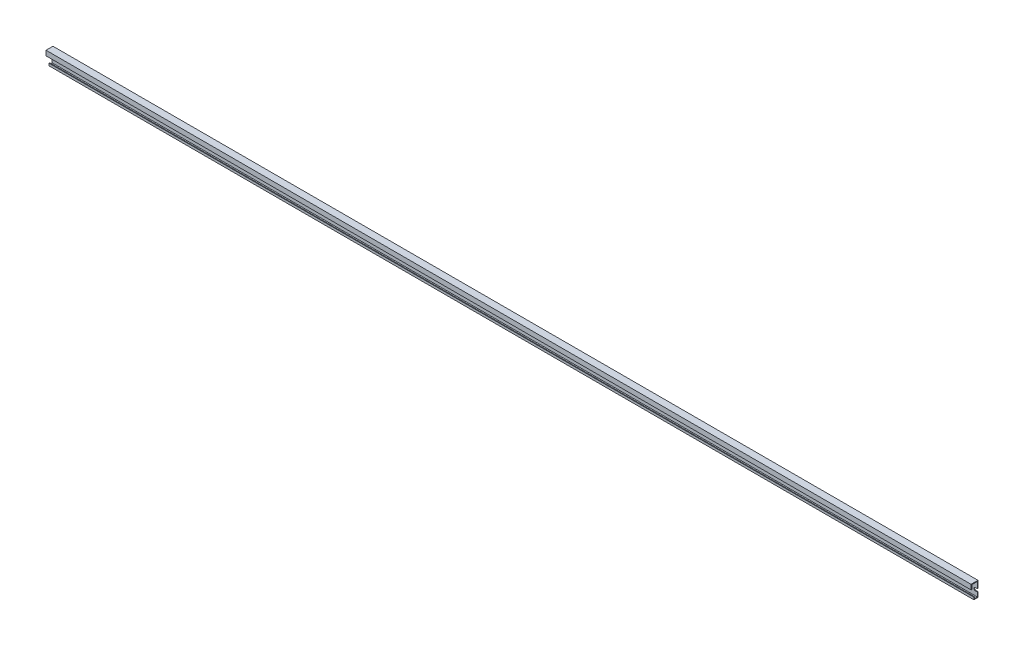
from build123d import *

# Parameters (mm, degrees)
SKETCH1_W           = 2000
SKETCH1_H           = 9
BOSS_EXTRUDE1_DEPTH = 5
SKETCH2_W           = 7.5
SKETCH2_H           = 3.5
CUT_EXTRUDE1_DEPTH  = 2001.084248226
SKETCH3_W           = 2000
SKETCH3_H           = 1.5
BOSS_EXTRUDE2_DEPTH = 30.5
SKETCH4_W           = 2000
SKETCH4_H           = 1.5
BOSS_EXTRUDE3_DEPTH = 13.5
SKETCH5_W           = 2000
SKETCH5_H           = 1.5
BOSS_EXTRUDE4_DEPTH = 9
CUT_EXTRUDE2_DEPTH  = 2001.120246385
CUT_EXTRUDE3_DEPTH  = 2001.120246385
CUT_EXTRUDE4_DEPTH  = 2001.109559499
CUT_EXTRUDE5_DEPTH  = 2001.109559499
CUT_EXTRUDE6_DEPTH  = 2001.109559499
CUT_EXTRUDE7_DEPTH  = 2001.109559499
CUT_EXTRUDE8_DEPTH  = 2001.109559499
CUT_EXTRUDE9_DEPTH  = 2001.109559499
CUT_EXTRUDE10_DEPTH = 2001.109559499
CUT_EXTRUDE11_DEPTH = 2001.109559499
CUT_EXTRUDE12_DEPTH = 2001.109559499
CUT_EXTRUDE13_DEPTH = 2001.109559499
CUT_EXTRUDE14_DEPTH = 2001.109559499
CUT_EXTRUDE15_DEPTH = 2001.109559499
CUT_EXTRUDE16_DEPTH = 2001.109559499
CUT_EXTRUDE17_DEPTH = 2001.109559499
CUT_EXTRUDE18_DEPTH = 2001.109559499
CUT_EXTRUDE19_DEPTH = 2001.109559499
CUT_EXTRUDE20_DEPTH = 2001.109559499
CUT_EXTRUDE21_DEPTH = 2001.109559499
CUT_EXTRUDE22_DEPTH = 2001.109559499
CUT_EXTRUDE23_DEPTH = 2001.109559499
CUT_EXTRUDE24_DEPTH = 2001.109559499
CUT_EXTRUDE25_DEPTH = 2001.109559499
CUT_EXTRUDE26_DEPTH = 2001.109559499
CUT_EXTRUDE27_DEPTH = 2001.109559499
CUT_EXTRUDE28_DEPTH = 2001.109559499
CUT_EXTRUDE29_DEPTH = 2001.109559499
CUT_EXTRUDE30_DEPTH = 2001.109559499
CUT_EXTRUDE31_DEPTH = 2001.109559499
CUT_EXTRUDE32_DEPTH = 2001.109559499
CUT_EXTRUDE33_DEPTH = 2001.109559499
CUT_EXTRUDE34_DEPTH = 2001.109559499
CUT_EXTRUDE35_DEPTH = 2001.109559499
CUT_EXTRUDE36_DEPTH = 2001.109559499
CUT_EXTRUDE37_DEPTH = 2001.109559499
CUT_EXTRUDE38_DEPTH = 2001.109559499
CUT_EXTRUDE39_DEPTH = 2001.109559499
CUT_EXTRUDE40_DEPTH = 2001.109559499
CUT_EXTRUDE41_DEPTH = 2001.109559499
CUT_EXTRUDE42_DEPTH = 2001.109559499
CUT_EXTRUDE43_DEPTH = 2001.109559499
CUT_EXTRUDE44_DEPTH = 2001.109559499
CUT_EXTRUDE45_DEPTH = 2001.109559499
CUT_EXTRUDE46_DEPTH = 2001.109559499
CUT_EXTRUDE47_DEPTH = 2001.109559499
CUT_EXTRUDE48_DEPTH = 2001.109559499
CUT_EXTRUDE49_DEPTH = 2001.109559499
CUT_EXTRUDE50_DEPTH = 2001.109559499
CUT_EXTRUDE51_DEPTH = 2001.109559499
CUT_EXTRUDE52_DEPTH = 2001.109559499
CUT_EXTRUDE53_DEPTH = 2001.109559499
CUT_EXTRUDE54_DEPTH = 2001.109559499
CUT_EXTRUDE55_DEPTH = 2001.109559499
CUT_EXTRUDE56_DEPTH = 2001.109559499
CUT_EXTRUDE57_DEPTH = 2001.109559499
CUT_EXTRUDE58_DEPTH = 2001.109559499
CUT_EXTRUDE59_DEPTH = 2001.109559499
CUT_EXTRUDE60_DEPTH = 2001.109559499
CUT_EXTRUDE61_DEPTH = 2001.109559499
CUT_EXTRUDE62_DEPTH = 2001.109559499
CUT_EXTRUDE63_DEPTH = 2001.109559499
CUT_EXTRUDE64_DEPTH = 2001.109559499
CUT_EXTRUDE65_DEPTH = 2001.109559499
CUT_EXTRUDE66_DEPTH = 2001.109559499
CUT_EXTRUDE67_DEPTH = 2001.109559499
CUT_EXTRUDE68_DEPTH = 2001.109559499
CUT_EXTRUDE69_DEPTH = 2001.109559499
CUT_EXTRUDE70_DEPTH = 2001.109559499
CUT_EXTRUDE71_DEPTH = 2001.109559499
CUT_EXTRUDE72_DEPTH = 2001.109559499
CUT_EXTRUDE73_DEPTH = 2001.109559499
CUT_EXTRUDE74_DEPTH = 2001.109559499
CUT_EXTRUDE75_DEPTH = 2001.109559499
CUT_EXTRUDE76_DEPTH = 2001.109559499
CUT_EXTRUDE77_DEPTH = 2001.109559499
CUT_EXTRUDE78_DEPTH = 2001.109559499
CUT_EXTRUDE79_DEPTH = 2001.109559499
CUT_EXTRUDE80_DEPTH = 2001.109559499
CUT_EXTRUDE81_DEPTH = 2001.109559499
CUT_EXTRUDE82_DEPTH = 2001.120246385


with BuildPart() as part:
    # Sketch1 → Boss-Extrude1 (new body)
    with BuildSketch(Plane(origin=(0, -11, 0), x_dir=(1, 0, 0), z_dir=(0, 1, 0))):
        with Locations((1000, -4.5)):
            Rectangle(SKETCH1_W, SKETCH1_H)
    extrude(amount=-BOSS_EXTRUDE1_DEPTH)

    # Sketch2 → Cut-Extrude1 (cut, through all)
    with BuildSketch(Plane.ZY):
        with Locations((3.75, -12.75)):
            Rectangle(SKETCH2_W, SKETCH2_H)
    extrude(amount=-CUT_EXTRUDE1_DEPTH, mode=Mode.SUBTRACT)

    # Sketch3 → Boss-Extrude2 (add)
    with BuildSketch(Plane(origin=(0, -14.5, 0), x_dir=(-1, 0, 0), z_dir=(0, 1, 0))):
        with Locations((-1000, 0.75)):
            Rectangle(SKETCH3_W, SKETCH3_H)
    extrude(amount=BOSS_EXTRUDE2_DEPTH)

    # Sketch4 → Boss-Extrude3 (add)
    with BuildSketch(Plane.XY.offset(1.5)):
        with Locations((1000, 15.25)):
            Rectangle(SKETCH4_W, SKETCH4_H)
    extrude(amount=BOSS_EXTRUDE3_DEPTH)

    # Sketch5 → Boss-Extrude4 (add)
    with BuildSketch(Plane.XZ.offset(-14.5)):
        with Locations((1000, 14.25)):
            Rectangle(SKETCH5_W, SKETCH5_H)
    extrude(amount=BOSS_EXTRUDE4_DEPTH)

    # Sketch6 → Cut-Extrude2 (cut, through all)
    with BuildSketch(Plane(origin=(0, 0, 0), x_dir=(-1, 0, 0), z_dir=(0, 0, -1))):
        with BuildLine():
            Line((0, -5.1), (0, 1.1))
            Line((0, 1.1), (-4.4, 1.1))
            ThreePointArc((-4.4, 1.1), (-7.5, -2), (-4.4, -5.1))
            Line((-4.4, -5.1), (0, -5.1))
        make_face()
    extrude(amount=-CUT_EXTRUDE2_DEPTH, mode=Mode.SUBTRACT)

    # Sketch7 → Cut-Extrude3 (cut, through all)
    with BuildSketch(Plane(origin=(0, 0, 0), x_dir=(-1, 0, 0), z_dir=(0, 0, -1))):
        with BuildLine():
            Line((-2000, 1.1), (-2000, -5.1))
            Line((-2000, -5.1), (-1995.6, -5.1))
            ThreePointArc((-1995.6, -5.1), (-1992.5, -2), (-1995.6, 1.1))
            Line((-1995.6, 1.1), (-2000, 1.1))
        make_face()
    extrude(amount=-CUT_EXTRUDE3_DEPTH, mode=Mode.SUBTRACT)

    # Sketch8 → Cut-Extrude4 (cut, through all)
    with BuildSketch(Plane.XY.offset(1.5)):
        with BuildLine():
            Line((1229.4, 1.1), (1220.6, 1.1))
            ThreePointArc((1220.6, 1.1), (1217.5, -2), (1220.6, -5.1))
            Line((1220.6, -5.1), (1229.4, -5.1))
            ThreePointArc((1229.4, -5.1), (1232.5, -2), (1229.4, 1.1))
        make_face()
    extrude(amount=-CUT_EXTRUDE4_DEPTH, mode=Mode.SUBTRACT)

    # Sketch9 → Cut-Extrude5 (cut, through all)
    with BuildSketch(Plane.XY.offset(1.5)):
        with BuildLine():
            Line((279.4, 1.1), (270.6, 1.1))
            ThreePointArc((270.6, 1.1), (267.5, -2), (270.6, -5.1))
            Line((270.6, -5.1), (279.4, -5.1))
            ThreePointArc((279.4, -5.1), (282.5, -2), (279.4, 1.1))
        make_face()
    extrude(amount=-CUT_EXTRUDE5_DEPTH, mode=Mode.SUBTRACT)

    # Sketch10 → Cut-Extrude6 (cut, through all)
    with BuildSketch(Plane.XY.offset(1.5)):
        with BuildLine():
            Line((1404.4, 1.1), (1395.6, 1.1))
            ThreePointArc((1395.6, 1.1), (1392.5, -2), (1395.6, -5.1))
            Line((1395.6, -5.1), (1404.4, -5.1))
            ThreePointArc((1404.4, -5.1), (1407.5, -2), (1404.4, 1.1))
        make_face()
    extrude(amount=-CUT_EXTRUDE6_DEPTH, mode=Mode.SUBTRACT)

    # Sketch11 → Cut-Extrude7 (cut, through all)
    with BuildSketch(Plane.XY.offset(1.5)):
        with BuildLine():
            Line((1729.4, 1.1), (1720.6, 1.1))
            ThreePointArc((1720.6, 1.1), (1717.5, -2), (1720.6, -5.1))
            Line((1720.6, -5.1), (1729.4, -5.1))
            ThreePointArc((1729.4, -5.1), (1732.5, -2), (1729.4, 1.1))
        make_face()
    extrude(amount=-CUT_EXTRUDE7_DEPTH, mode=Mode.SUBTRACT)

    # Sketch12 → Cut-Extrude8 (cut, through all)
    with BuildSketch(Plane.XY.offset(1.5)):
        with BuildLine():
            Line((1954.4, 1.1), (1945.6, 1.1))
            ThreePointArc((1945.6, 1.1), (1942.5, -2), (1945.6, -5.1))
            Line((1945.6, -5.1), (1954.4, -5.1))
            ThreePointArc((1954.4, -5.1), (1957.5, -2), (1954.4, 1.1))
        make_face()
    extrude(amount=-CUT_EXTRUDE8_DEPTH, mode=Mode.SUBTRACT)

    # Sketch13 → Cut-Extrude9 (cut, through all)
    with BuildSketch(Plane.XY.offset(1.5)):
        with BuildLine():
            Line((679.4, 1.1), (670.6, 1.1))
            ThreePointArc((670.6, 1.1), (667.5, -2), (670.6, -5.1))
            Line((670.6, -5.1), (679.4, -5.1))
            ThreePointArc((679.4, -5.1), (682.5, -2), (679.4, 1.1))
        make_face()
    extrude(amount=-CUT_EXTRUDE9_DEPTH, mode=Mode.SUBTRACT)

    # Sketch14 → Cut-Extrude10 (cut, through all)
    with BuildSketch(Plane.XY.offset(1.5)):
        with BuildLine():
            Line((29.4, 1.1), (20.6, 1.1))
            ThreePointArc((20.6, 1.1), (17.5, -2), (20.6, -5.1))
            Line((20.6, -5.1), (29.4, -5.1))
            ThreePointArc((29.4, -5.1), (32.5, -2), (29.4, 1.1))
        make_face()
    extrude(amount=-CUT_EXTRUDE10_DEPTH, mode=Mode.SUBTRACT)

    # Sketch15 → Cut-Extrude11 (cut, through all)
    with BuildSketch(Plane.XY.offset(1.5)):
        with BuildLine():
            Line((1979.4, 1.1), (1970.6, 1.1))
            ThreePointArc((1970.6, 1.1), (1967.5, -2), (1970.6, -5.1))
            Line((1970.6, -5.1), (1979.4, -5.1))
            ThreePointArc((1979.4, -5.1), (1982.5, -2), (1979.4, 1.1))
        make_face()
    extrude(amount=-CUT_EXTRUDE11_DEPTH, mode=Mode.SUBTRACT)

    # Sketch16 → Cut-Extrude12 (cut, through all)
    with BuildSketch(Plane.XY.offset(1.5)):
        with BuildLine():
            Line((104.4, 1.1), (95.6, 1.1))
            ThreePointArc((95.6, 1.1), (92.5, -2), (95.6, -5.1))
            Line((95.6, -5.1), (104.4, -5.1))
            ThreePointArc((104.4, -5.1), (107.5, -2), (104.4, 1.1))
        make_face()
    extrude(amount=-CUT_EXTRUDE12_DEPTH, mode=Mode.SUBTRACT)

    # Sketch17 → Cut-Extrude13 (cut, through all)
    with BuildSketch(Plane.XY.offset(1.5)):
        with BuildLine():
            Line((1479.4, 1.1), (1470.6, 1.1))
            ThreePointArc((1470.6, 1.1), (1467.5, -2), (1470.6, -5.1))
            Line((1470.6, -5.1), (1479.4, -5.1))
            ThreePointArc((1479.4, -5.1), (1482.5, -2), (1479.4, 1.1))
        make_face()
    extrude(amount=-CUT_EXTRUDE13_DEPTH, mode=Mode.SUBTRACT)

    # Sketch18 → Cut-Extrude14 (cut, through all)
    with BuildSketch(Plane.XY.offset(1.5)):
        with BuildLine():
            Line((295.6, -5.1), (304.4, -5.1))
            ThreePointArc((304.4, -5.1), (307.5, -2), (304.4, 1.1))
            Line((304.4, 1.1), (295.6, 1.1))
            ThreePointArc((295.6, 1.1), (292.5, -2), (295.6, -5.1))
        make_face()
    extrude(amount=-CUT_EXTRUDE14_DEPTH, mode=Mode.SUBTRACT)

    # Sketch19 → Cut-Extrude15 (cut, through all)
    with BuildSketch(Plane.XY.offset(1.5)):
        with BuildLine():
            Line((170.6, -5.1), (179.4, -5.1))
            ThreePointArc((179.4, -5.1), (182.5, -2), (179.4, 1.1))
            Line((179.4, 1.1), (170.6, 1.1))
            ThreePointArc((170.6, 1.1), (167.5, -2), (170.6, -5.1))
        make_face()
    extrude(amount=-CUT_EXTRUDE15_DEPTH, mode=Mode.SUBTRACT)

    # Sketch20 → Cut-Extrude16 (cut, through all)
    with BuildSketch(Plane.XY.offset(1.5)):
        with BuildLine():
            Line((1320.6, -5.1), (1329.4, -5.1))
            ThreePointArc((1329.4, -5.1), (1332.5, -2), (1329.4, 1.1))
            Line((1329.4, 1.1), (1320.6, 1.1))
            ThreePointArc((1320.6, 1.1), (1317.5, -2), (1320.6, -5.1))
        make_face()
    extrude(amount=-CUT_EXTRUDE16_DEPTH, mode=Mode.SUBTRACT)

    # Sketch21 → Cut-Extrude17 (cut, through all)
    with BuildSketch(Plane.XY.offset(1.5)):
        with BuildLine():
            Line((704.4, 1.1), (695.6, 1.1))
            ThreePointArc((695.6, 1.1), (692.5, -2), (695.6, -5.1))
            Line((695.6, -5.1), (704.4, -5.1))
            ThreePointArc((704.4, -5.1), (707.5, -2), (704.4, 1.1))
        make_face()
    extrude(amount=-CUT_EXTRUDE17_DEPTH, mode=Mode.SUBTRACT)

    # Sketch22 → Cut-Extrude18 (cut, through all)
    with BuildSketch(Plane.XY.offset(1.5)):
        with BuildLine():
            Line((379.4, 1.1), (370.6, 1.1))
            ThreePointArc((370.6, 1.1), (367.5, -2), (370.6, -5.1))
            Line((370.6, -5.1), (379.4, -5.1))
            ThreePointArc((379.4, -5.1), (382.5, -2), (379.4, 1.1))
        make_face()
    extrude(amount=-CUT_EXTRUDE18_DEPTH, mode=Mode.SUBTRACT)

    # Sketch23 → Cut-Extrude19 (cut, through all)
    with BuildSketch(Plane.XY.offset(1.5)):
        with BuildLine():
            Line((1554.4, 1.1), (1545.6, 1.1))
            ThreePointArc((1545.6, 1.1), (1542.5, -2), (1545.6, -5.1))
            Line((1545.6, -5.1), (1554.4, -5.1))
            ThreePointArc((1554.4, -5.1), (1557.5, -2), (1554.4, 1.1))
        make_face()
    extrude(amount=-CUT_EXTRUDE19_DEPTH, mode=Mode.SUBTRACT)

    # Sketch24 → Cut-Extrude20 (cut, through all)
    with BuildSketch(Plane.XY.offset(1.5)):
        with BuildLine():
            Line((1704.4, 1.1), (1695.6, 1.1))
            ThreePointArc((1695.6, 1.1), (1692.5, -2), (1695.6, -5.1))
            Line((1695.6, -5.1), (1704.4, -5.1))
            ThreePointArc((1704.4, -5.1), (1707.5, -2), (1704.4, 1.1))
        make_face()
    extrude(amount=-CUT_EXTRUDE20_DEPTH, mode=Mode.SUBTRACT)

    # Sketch25 → Cut-Extrude21 (cut, through all)
    with BuildSketch(Plane.XY.offset(1.5)):
        with BuildLine():
            Line((1004.4, 1.1), (995.6, 1.1))
            ThreePointArc((995.6, 1.1), (992.5, -2), (995.6, -5.1))
            Line((995.6, -5.1), (1004.4, -5.1))
            ThreePointArc((1004.4, -5.1), (1007.5, -2), (1004.4, 1.1))
        make_face()
    extrude(amount=-CUT_EXTRUDE21_DEPTH, mode=Mode.SUBTRACT)

    # Sketch26 → Cut-Extrude22 (cut, through all)
    with BuildSketch(Plane.XY.offset(1.5)):
        with BuildLine():
            Line((545.6, -5.1), (554.4, -5.1))
            ThreePointArc((554.4, -5.1), (557.5, -2), (554.4, 1.1))
            Line((554.4, 1.1), (545.6, 1.1))
            ThreePointArc((545.6, 1.1), (542.5, -2), (545.6, -5.1))
        make_face()
    extrude(amount=-CUT_EXTRUDE22_DEPTH, mode=Mode.SUBTRACT)

    # Sketch27 → Cut-Extrude23 (cut, through all)
    with BuildSketch(Plane.XY.offset(1.5)):
        with BuildLine():
            Line((845.6, -5.1), (854.4, -5.1))
            ThreePointArc((854.4, -5.1), (857.5, -2), (854.4, 1.1))
            Line((854.4, 1.1), (845.6, 1.1))
            ThreePointArc((845.6, 1.1), (842.5, -2), (845.6, -5.1))
        make_face()
    extrude(amount=-CUT_EXTRUDE23_DEPTH, mode=Mode.SUBTRACT)

    # Sketch28 → Cut-Extrude24 (cut, through all)
    with BuildSketch(Plane.XY.offset(1.5)):
        with BuildLine():
            Line((879.4, 1.1), (870.6, 1.1))
            ThreePointArc((870.6, 1.1), (867.5, -2), (870.6, -5.1))
            Line((870.6, -5.1), (879.4, -5.1))
            ThreePointArc((879.4, -5.1), (882.5, -2), (879.4, 1.1))
        make_face()
    extrude(amount=-CUT_EXTRUDE24_DEPTH, mode=Mode.SUBTRACT)

    # Sketch29 → Cut-Extrude25 (cut, through all)
    with BuildSketch(Plane.XY.offset(1.5)):
        with BuildLine():
            Line((354.4, 1.1), (345.6, 1.1))
            ThreePointArc((345.6, 1.1), (342.5, -2), (345.6, -5.1))
            Line((345.6, -5.1), (354.4, -5.1))
            ThreePointArc((354.4, -5.1), (357.5, -2), (354.4, 1.1))
        make_face()
    extrude(amount=-CUT_EXTRUDE25_DEPTH, mode=Mode.SUBTRACT)

    # Sketch30 → Cut-Extrude26 (cut, through all)
    with BuildSketch(Plane.XY.offset(1.5)):
        with BuildLine():
            Line((1679.4, 1.1), (1670.6, 1.1))
            ThreePointArc((1670.6, 1.1), (1667.5, -2), (1670.6, -5.1))
            Line((1670.6, -5.1), (1679.4, -5.1))
            ThreePointArc((1679.4, -5.1), (1682.5, -2), (1679.4, 1.1))
        make_face()
    extrude(amount=-CUT_EXTRUDE26_DEPTH, mode=Mode.SUBTRACT)

    # Sketch31 → Cut-Extrude27 (cut, through all)
    with BuildSketch(Plane.XY.offset(1.5)):
        with BuildLine():
            Line((395.6, -5.1), (404.4, -5.1))
            ThreePointArc((404.4, -5.1), (407.5, -2), (404.4, 1.1))
            Line((404.4, 1.1), (395.6, 1.1))
            ThreePointArc((395.6, 1.1), (392.5, -2), (395.6, -5.1))
        make_face()
    extrude(amount=-CUT_EXTRUDE27_DEPTH, mode=Mode.SUBTRACT)

    # Sketch32 → Cut-Extrude28 (cut, through all)
    with BuildSketch(Plane.XY.offset(1.5)):
        with BuildLine():
            Line((1454.4, 1.1), (1445.6, 1.1))
            ThreePointArc((1445.6, 1.1), (1442.5, -2), (1445.6, -5.1))
            Line((1445.6, -5.1), (1454.4, -5.1))
            ThreePointArc((1454.4, -5.1), (1457.5, -2), (1454.4, 1.1))
        make_face()
    extrude(amount=-CUT_EXTRUDE28_DEPTH, mode=Mode.SUBTRACT)

    # Sketch33 → Cut-Extrude29 (cut, through all)
    with BuildSketch(Plane.XY.offset(1.5)):
        with BuildLine():
            Line((54.4, 1.1), (45.6, 1.1))
            ThreePointArc((45.6, 1.1), (42.5, -2), (45.6, -5.1))
            Line((45.6, -5.1), (54.4, -5.1))
            ThreePointArc((54.4, -5.1), (57.5, -2), (54.4, 1.1))
        make_face()
    extrude(amount=-CUT_EXTRUDE29_DEPTH, mode=Mode.SUBTRACT)

    # Sketch34 → Cut-Extrude30 (cut, through all)
    with BuildSketch(Plane.XY.offset(1.5)):
        with BuildLine():
            Line((1604.4, 1.1), (1595.6, 1.1))
            ThreePointArc((1595.6, 1.1), (1592.5, -2), (1595.6, -5.1))
            Line((1595.6, -5.1), (1604.4, -5.1))
            ThreePointArc((1604.4, -5.1), (1607.5, -2), (1604.4, 1.1))
        make_face()
    extrude(amount=-CUT_EXTRUDE30_DEPTH, mode=Mode.SUBTRACT)

    # Sketch35 → Cut-Extrude31 (cut, through all)
    with BuildSketch(Plane.XY.offset(1.5)):
        with BuildLine():
            Line((1929.4, 1.1), (1920.6, 1.1))
            ThreePointArc((1920.6, 1.1), (1917.5, -2), (1920.6, -5.1))
            Line((1920.6, -5.1), (1929.4, -5.1))
            ThreePointArc((1929.4, -5.1), (1932.5, -2), (1929.4, 1.1))
        make_face()
    extrude(amount=-CUT_EXTRUDE31_DEPTH, mode=Mode.SUBTRACT)

    # Sketch36 → Cut-Extrude32 (cut, through all)
    with BuildSketch(Plane.XY.offset(1.5)):
        with BuildLine():
            Line((570.6, -5.1), (579.4, -5.1))
            ThreePointArc((579.4, -5.1), (582.5, -2), (579.4, 1.1))
            Line((579.4, 1.1), (570.6, 1.1))
            ThreePointArc((570.6, 1.1), (567.5, -2), (570.6, -5.1))
        make_face()
    extrude(amount=-CUT_EXTRUDE32_DEPTH, mode=Mode.SUBTRACT)

    # Sketch37 → Cut-Extrude33 (cut, through all)
    with BuildSketch(Plane.XY.offset(1.5)):
        with BuildLine():
            Line((979.4, 1.1), (970.6, 1.1))
            ThreePointArc((970.6, 1.1), (967.5, -2), (970.6, -5.1))
            Line((970.6, -5.1), (979.4, -5.1))
            ThreePointArc((979.4, -5.1), (982.5, -2), (979.4, 1.1))
        make_face()
    extrude(amount=-CUT_EXTRUDE33_DEPTH, mode=Mode.SUBTRACT)

    # Sketch38 → Cut-Extrude34 (cut, through all)
    with BuildSketch(Plane.XY.offset(1.5)):
        with BuildLine():
            Line((1629.4, 1.1), (1620.6, 1.1))
            ThreePointArc((1620.6, 1.1), (1617.5, -2), (1620.6, -5.1))
            Line((1620.6, -5.1), (1629.4, -5.1))
            ThreePointArc((1629.4, -5.1), (1632.5, -2), (1629.4, 1.1))
        make_face()
    extrude(amount=-CUT_EXTRUDE34_DEPTH, mode=Mode.SUBTRACT)

    # Sketch39 → Cut-Extrude35 (cut, through all)
    with BuildSketch(Plane.XY.offset(1.5)):
        with BuildLine():
            Line((145.6, -5.1), (154.4, -5.1))
            ThreePointArc((154.4, -5.1), (157.5, -2), (154.4, 1.1))
            Line((154.4, 1.1), (145.6, 1.1))
            ThreePointArc((145.6, 1.1), (142.5, -2), (145.6, -5.1))
        make_face()
    extrude(amount=-CUT_EXTRUDE35_DEPTH, mode=Mode.SUBTRACT)

    # Sketch40 → Cut-Extrude36 (cut, through all)
    with BuildSketch(Plane.XY.offset(1.5)):
        with BuildLine():
            Line((1304.4, 1.1), (1295.6, 1.1))
            ThreePointArc((1295.6, 1.1), (1292.5, -2), (1295.6, -5.1))
            Line((1295.6, -5.1), (1304.4, -5.1))
            ThreePointArc((1304.4, -5.1), (1307.5, -2), (1304.4, 1.1))
        make_face()
    extrude(amount=-CUT_EXTRUDE36_DEPTH, mode=Mode.SUBTRACT)

    # Sketch41 → Cut-Extrude37 (cut, through all)
    with BuildSketch(Plane.XY.offset(1.5)):
        with BuildLine():
            Line((1854.4, 1.1), (1845.6, 1.1))
            ThreePointArc((1845.6, 1.1), (1842.5, -2), (1845.6, -5.1))
            Line((1845.6, -5.1), (1854.4, -5.1))
            ThreePointArc((1854.4, -5.1), (1857.5, -2), (1854.4, 1.1))
        make_face()
    extrude(amount=-CUT_EXTRUDE37_DEPTH, mode=Mode.SUBTRACT)

    # Sketch42 → Cut-Extrude38 (cut, through all)
    with BuildSketch(Plane.XY.offset(1.5)):
        with BuildLine():
            Line((1879.4, 1.1), (1870.6, 1.1))
            ThreePointArc((1870.6, 1.1), (1867.5, -2), (1870.6, -5.1))
            Line((1870.6, -5.1), (1879.4, -5.1))
            ThreePointArc((1879.4, -5.1), (1882.5, -2), (1879.4, 1.1))
        make_face()
    extrude(amount=-CUT_EXTRUDE38_DEPTH, mode=Mode.SUBTRACT)

    # Sketch43 → Cut-Extrude39 (cut, through all)
    with BuildSketch(Plane.XY.offset(1.5)):
        with BuildLine():
            Line((729.4, 1.1), (720.6, 1.1))
            ThreePointArc((720.6, 1.1), (717.5, -2), (720.6, -5.1))
            Line((720.6, -5.1), (729.4, -5.1))
            ThreePointArc((729.4, -5.1), (732.5, -2), (729.4, 1.1))
        make_face()
    extrude(amount=-CUT_EXTRUDE39_DEPTH, mode=Mode.SUBTRACT)

    # Sketch44 → Cut-Extrude40 (cut, through all)
    with BuildSketch(Plane.XY.offset(1.5)):
        with BuildLine():
            Line((1504.4, 1.1), (1495.6, 1.1))
            ThreePointArc((1495.6, 1.1), (1492.5, -2), (1495.6, -5.1))
            Line((1495.6, -5.1), (1504.4, -5.1))
            ThreePointArc((1504.4, -5.1), (1507.5, -2), (1504.4, 1.1))
        make_face()
    extrude(amount=-CUT_EXTRUDE40_DEPTH, mode=Mode.SUBTRACT)

    # Sketch45 → Cut-Extrude41 (cut, through all)
    with BuildSketch(Plane.XY.offset(1.5)):
        with BuildLine():
            Line((1420.6, -5.1), (1429.4, -5.1))
            ThreePointArc((1429.4, -5.1), (1432.5, -2), (1429.4, 1.1))
            Line((1429.4, 1.1), (1420.6, 1.1))
            ThreePointArc((1420.6, 1.1), (1417.5, -2), (1420.6, -5.1))
        make_face()
    extrude(amount=-CUT_EXTRUDE41_DEPTH, mode=Mode.SUBTRACT)

    # Sketch46 → Cut-Extrude42 (cut, through all)
    with BuildSketch(Plane.XY.offset(1.5)):
        with BuildLine():
            Line((629.4, 1.1), (620.6, 1.1))
            ThreePointArc((620.6, 1.1), (617.5, -2), (620.6, -5.1))
            Line((620.6, -5.1), (629.4, -5.1))
            ThreePointArc((629.4, -5.1), (632.5, -2), (629.4, 1.1))
        make_face()
    extrude(amount=-CUT_EXTRUDE42_DEPTH, mode=Mode.SUBTRACT)

    # Sketch47 → Cut-Extrude43 (cut, through all)
    with BuildSketch(Plane.XY.offset(1.5)):
        with BuildLine():
            Line((1270.6, -5.1), (1279.4, -5.1))
            ThreePointArc((1279.4, -5.1), (1282.5, -2), (1279.4, 1.1))
            Line((1279.4, 1.1), (1270.6, 1.1))
            ThreePointArc((1270.6, 1.1), (1267.5, -2), (1270.6, -5.1))
        make_face()
    extrude(amount=-CUT_EXTRUDE43_DEPTH, mode=Mode.SUBTRACT)

    # Sketch48 → Cut-Extrude44 (cut, through all)
    with BuildSketch(Plane.XY.offset(1.5)):
        with BuildLine():
            Line((1379.4, 1.1), (1370.6, 1.1))
            ThreePointArc((1370.6, 1.1), (1367.5, -2), (1370.6, -5.1))
            Line((1370.6, -5.1), (1379.4, -5.1))
            ThreePointArc((1379.4, -5.1), (1382.5, -2), (1379.4, 1.1))
        make_face()
    extrude(amount=-CUT_EXTRUDE44_DEPTH, mode=Mode.SUBTRACT)

    # Sketch49 → Cut-Extrude45 (cut, through all)
    with BuildSketch(Plane.XY.offset(1.5)):
        with BuildLine():
            Line((1529.4, 1.1), (1520.6, 1.1))
            ThreePointArc((1520.6, 1.1), (1517.5, -2), (1520.6, -5.1))
            Line((1520.6, -5.1), (1529.4, -5.1))
            ThreePointArc((1529.4, -5.1), (1532.5, -2), (1529.4, 1.1))
        make_face()
    extrude(amount=-CUT_EXTRUDE45_DEPTH, mode=Mode.SUBTRACT)

    # Sketch50 → Cut-Extrude46 (cut, through all)
    with BuildSketch(Plane.XY.offset(1.5)):
        with BuildLine():
            Line((920.6, -5.1), (929.4, -5.1))
            ThreePointArc((929.4, -5.1), (932.5, -2), (929.4, 1.1))
            Line((929.4, 1.1), (920.6, 1.1))
            ThreePointArc((920.6, 1.1), (917.5, -2), (920.6, -5.1))
        make_face()
    extrude(amount=-CUT_EXTRUDE46_DEPTH, mode=Mode.SUBTRACT)

    # Sketch51 → Cut-Extrude47 (cut, through all)
    with BuildSketch(Plane.XY.offset(1.5)):
        with BuildLine():
            Line((1154.4, 1.1), (1145.6, 1.1))
            ThreePointArc((1145.6, 1.1), (1142.5, -2), (1145.6, -5.1))
            Line((1145.6, -5.1), (1154.4, -5.1))
            ThreePointArc((1154.4, -5.1), (1157.5, -2), (1154.4, 1.1))
        make_face()
    extrude(amount=-CUT_EXTRUDE47_DEPTH, mode=Mode.SUBTRACT)

    # Sketch52 → Cut-Extrude48 (cut, through all)
    with BuildSketch(Plane.XY.offset(1.5)):
        with BuildLine():
            Line((654.4, 1.1), (645.6, 1.1))
            ThreePointArc((645.6, 1.1), (642.5, -2), (645.6, -5.1))
            Line((645.6, -5.1), (654.4, -5.1))
            ThreePointArc((654.4, -5.1), (657.5, -2), (654.4, 1.1))
        make_face()
    extrude(amount=-CUT_EXTRUDE48_DEPTH, mode=Mode.SUBTRACT)

    # Sketch53 → Cut-Extrude49 (cut, through all)
    with BuildSketch(Plane.XY.offset(1.5)):
        with BuildLine():
            Line((1254.4, 1.1), (1245.6, 1.1))
            ThreePointArc((1245.6, 1.1), (1242.5, -2), (1245.6, -5.1))
            Line((1245.6, -5.1), (1254.4, -5.1))
            ThreePointArc((1254.4, -5.1), (1257.5, -2), (1254.4, 1.1))
        make_face()
    extrude(amount=-CUT_EXTRUDE49_DEPTH, mode=Mode.SUBTRACT)

    # Sketch54 → Cut-Extrude50 (cut, through all)
    with BuildSketch(Plane.XY.offset(1.5)):
        with BuildLine():
            Line((954.4, 1.1), (945.6, 1.1))
            ThreePointArc((945.6, 1.1), (942.5, -2), (945.6, -5.1))
            Line((945.6, -5.1), (954.4, -5.1))
            ThreePointArc((954.4, -5.1), (957.5, -2), (954.4, 1.1))
        make_face()
    extrude(amount=-CUT_EXTRUDE50_DEPTH, mode=Mode.SUBTRACT)

    # Sketch55 → Cut-Extrude51 (cut, through all)
    with BuildSketch(Plane.XY.offset(1.5)):
        with BuildLine():
            Line((1104.4, 1.1), (1095.6, 1.1))
            ThreePointArc((1095.6, 1.1), (1092.5, -2), (1095.6, -5.1))
            Line((1095.6, -5.1), (1104.4, -5.1))
            ThreePointArc((1104.4, -5.1), (1107.5, -2), (1104.4, 1.1))
        make_face()
    extrude(amount=-CUT_EXTRUDE51_DEPTH, mode=Mode.SUBTRACT)

    # Sketch56 → Cut-Extrude52 (cut, through all)
    with BuildSketch(Plane.XY.offset(1.5)):
        with BuildLine():
            Line((1079.4, 1.1), (1070.6, 1.1))
            ThreePointArc((1070.6, 1.1), (1067.5, -2), (1070.6, -5.1))
            Line((1070.6, -5.1), (1079.4, -5.1))
            ThreePointArc((1079.4, -5.1), (1082.5, -2), (1079.4, 1.1))
        make_face()
    extrude(amount=-CUT_EXTRUDE52_DEPTH, mode=Mode.SUBTRACT)

    # Sketch57 → Cut-Extrude53 (cut, through all)
    with BuildSketch(Plane.XY.offset(1.5)):
        with BuildLine():
            Line((770.6, -5.1), (779.4, -5.1))
            ThreePointArc((779.4, -5.1), (782.5, -2), (779.4, 1.1))
            Line((779.4, 1.1), (770.6, 1.1))
            ThreePointArc((770.6, 1.1), (767.5, -2), (770.6, -5.1))
        make_face()
    extrude(amount=-CUT_EXTRUDE53_DEPTH, mode=Mode.SUBTRACT)

    # Sketch58 → Cut-Extrude54 (cut, through all)
    with BuildSketch(Plane.XY.offset(1.5)):
        with BuildLine():
            Line((1179.4, 1.1), (1170.6, 1.1))
            ThreePointArc((1170.6, 1.1), (1167.5, -2), (1170.6, -5.1))
            Line((1170.6, -5.1), (1179.4, -5.1))
            ThreePointArc((1179.4, -5.1), (1182.5, -2), (1179.4, 1.1))
        make_face()
    extrude(amount=-CUT_EXTRUDE54_DEPTH, mode=Mode.SUBTRACT)

    # Sketch59 → Cut-Extrude55 (cut, through all)
    with BuildSketch(Plane.XY.offset(1.5)):
        with BuildLine():
            Line((1579.4, 1.1), (1570.6, 1.1))
            ThreePointArc((1570.6, 1.1), (1567.5, -2), (1570.6, -5.1))
            Line((1570.6, -5.1), (1579.4, -5.1))
            ThreePointArc((1579.4, -5.1), (1582.5, -2), (1579.4, 1.1))
        make_face()
    extrude(amount=-CUT_EXTRUDE55_DEPTH, mode=Mode.SUBTRACT)

    # Sketch60 → Cut-Extrude56 (cut, through all)
    with BuildSketch(Plane.XY.offset(1.5)):
        with BuildLine():
            Line((1054.4, 1.1), (1045.6, 1.1))
            ThreePointArc((1045.6, 1.1), (1042.5, -2), (1045.6, -5.1))
            Line((1045.6, -5.1), (1054.4, -5.1))
            ThreePointArc((1054.4, -5.1), (1057.5, -2), (1054.4, 1.1))
        make_face()
    extrude(amount=-CUT_EXTRUDE56_DEPTH, mode=Mode.SUBTRACT)

    # Sketch61 → Cut-Extrude57 (cut, through all)
    with BuildSketch(Plane.XY.offset(1.5)):
        with BuildLine():
            Line((420.6, -5.1), (429.4, -5.1))
            ThreePointArc((429.4, -5.1), (432.5, -2), (429.4, 1.1))
            Line((429.4, 1.1), (420.6, 1.1))
            ThreePointArc((420.6, 1.1), (417.5, -2), (420.6, -5.1))
        make_face()
    extrude(amount=-CUT_EXTRUDE57_DEPTH, mode=Mode.SUBTRACT)

    # Sketch62 → Cut-Extrude58 (cut, through all)
    with BuildSketch(Plane.XY.offset(1.5)):
        with BuildLine():
            Line((1654.4, 1.1), (1645.6, 1.1))
            ThreePointArc((1645.6, 1.1), (1642.5, -2), (1645.6, -5.1))
            Line((1645.6, -5.1), (1654.4, -5.1))
            ThreePointArc((1654.4, -5.1), (1657.5, -2), (1654.4, 1.1))
        make_face()
    extrude(amount=-CUT_EXTRUDE58_DEPTH, mode=Mode.SUBTRACT)

    # Sketch63 → Cut-Extrude59 (cut, through all)
    with BuildSketch(Plane.XY.offset(1.5)):
        with BuildLine():
            Line((820.6, -5.1), (829.4, -5.1))
            ThreePointArc((829.4, -5.1), (832.5, -2), (829.4, 1.1))
            Line((829.4, 1.1), (820.6, 1.1))
            ThreePointArc((820.6, 1.1), (817.5, -2), (820.6, -5.1))
        make_face()
    extrude(amount=-CUT_EXTRUDE59_DEPTH, mode=Mode.SUBTRACT)

    # Sketch64 → Cut-Extrude60 (cut, through all)
    with BuildSketch(Plane.XY.offset(1.5)):
        with BuildLine():
            Line((1829.4, 1.1), (1820.6, 1.1))
            ThreePointArc((1820.6, 1.1), (1817.5, -2), (1820.6, -5.1))
            Line((1820.6, -5.1), (1829.4, -5.1))
            ThreePointArc((1829.4, -5.1), (1832.5, -2), (1829.4, 1.1))
        make_face()
    extrude(amount=-CUT_EXTRUDE60_DEPTH, mode=Mode.SUBTRACT)

    # Sketch65 → Cut-Extrude61 (cut, through all)
    with BuildSketch(Plane.XY.offset(1.5)):
        with BuildLine():
            Line((1904.4, 1.1), (1895.6, 1.1))
            ThreePointArc((1895.6, 1.1), (1892.5, -2), (1895.6, -5.1))
            Line((1895.6, -5.1), (1904.4, -5.1))
            ThreePointArc((1904.4, -5.1), (1907.5, -2), (1904.4, 1.1))
        make_face()
    extrude(amount=-CUT_EXTRUDE61_DEPTH, mode=Mode.SUBTRACT)

    # Sketch66 → Cut-Extrude62 (cut, through all)
    with BuildSketch(Plane.XY.offset(1.5)):
        with BuildLine():
            Line((804.4, 1.1), (795.6, 1.1))
            ThreePointArc((795.6, 1.1), (792.5, -2), (795.6, -5.1))
            Line((795.6, -5.1), (804.4, -5.1))
            ThreePointArc((804.4, -5.1), (807.5, -2), (804.4, 1.1))
        make_face()
    extrude(amount=-CUT_EXTRUDE62_DEPTH, mode=Mode.SUBTRACT)

    # Sketch67 → Cut-Extrude63 (cut, through all)
    with BuildSketch(Plane.XY.offset(1.5)):
        with BuildLine():
            Line((70.6, -5.1), (79.4, -5.1))
            ThreePointArc((79.4, -5.1), (82.5, -2), (79.4, 1.1))
            Line((79.4, 1.1), (70.6, 1.1))
            ThreePointArc((70.6, 1.1), (67.5, -2), (70.6, -5.1))
        make_face()
    extrude(amount=-CUT_EXTRUDE63_DEPTH, mode=Mode.SUBTRACT)

    # Sketch68 → Cut-Extrude64 (cut, through all)
    with BuildSketch(Plane.XY.offset(1.5)):
        with BuildLine():
            Line((1204.4, 1.1), (1195.6, 1.1))
            ThreePointArc((1195.6, 1.1), (1192.5, -2), (1195.6, -5.1))
            Line((1195.6, -5.1), (1204.4, -5.1))
            ThreePointArc((1204.4, -5.1), (1207.5, -2), (1204.4, 1.1))
        make_face()
    extrude(amount=-CUT_EXTRUDE64_DEPTH, mode=Mode.SUBTRACT)

    # Sketch69 → Cut-Extrude65 (cut, through all)
    with BuildSketch(Plane.XY.offset(1.5)):
        with BuildLine():
            Line((454.4, 1.1), (445.6, 1.1))
            ThreePointArc((445.6, 1.1), (442.5, -2), (445.6, -5.1))
            Line((445.6, -5.1), (454.4, -5.1))
            ThreePointArc((454.4, -5.1), (457.5, -2), (454.4, 1.1))
        make_face()
    extrude(amount=-CUT_EXTRUDE65_DEPTH, mode=Mode.SUBTRACT)

    # Sketch70 → Cut-Extrude66 (cut, through all)
    with BuildSketch(Plane.XY.offset(1.5)):
        with BuildLine():
            Line((520.6, -5.1), (529.4, -5.1))
            ThreePointArc((529.4, -5.1), (532.5, -2), (529.4, 1.1))
            Line((529.4, 1.1), (520.6, 1.1))
            ThreePointArc((520.6, 1.1), (517.5, -2), (520.6, -5.1))
        make_face()
    extrude(amount=-CUT_EXTRUDE66_DEPTH, mode=Mode.SUBTRACT)

    # Sketch71 → Cut-Extrude67 (cut, through all)
    with BuildSketch(Plane.XY.offset(1.5)):
        with BuildLine():
            Line((1129.4, 1.1), (1120.6, 1.1))
            ThreePointArc((1120.6, 1.1), (1117.5, -2), (1120.6, -5.1))
            Line((1120.6, -5.1), (1129.4, -5.1))
            ThreePointArc((1129.4, -5.1), (1132.5, -2), (1129.4, 1.1))
        make_face()
    extrude(amount=-CUT_EXTRUDE67_DEPTH, mode=Mode.SUBTRACT)

    # Sketch72 → Cut-Extrude68 (cut, through all)
    with BuildSketch(Plane.XY.offset(1.5)):
        with BuildLine():
            Line((1029.4, 1.1), (1020.6, 1.1))
            ThreePointArc((1020.6, 1.1), (1017.5, -2), (1020.6, -5.1))
            Line((1020.6, -5.1), (1029.4, -5.1))
            ThreePointArc((1029.4, -5.1), (1032.5, -2), (1029.4, 1.1))
        make_face()
    extrude(amount=-CUT_EXTRUDE68_DEPTH, mode=Mode.SUBTRACT)

    # Sketch73 → Cut-Extrude69 (cut, through all)
    with BuildSketch(Plane.XY.offset(1.5)):
        with BuildLine():
            Line((229.4, 1.1), (220.6, 1.1))
            ThreePointArc((220.6, 1.1), (217.5, -2), (220.6, -5.1))
            Line((220.6, -5.1), (229.4, -5.1))
            ThreePointArc((229.4, -5.1), (232.5, -2), (229.4, 1.1))
        make_face()
    extrude(amount=-CUT_EXTRUDE69_DEPTH, mode=Mode.SUBTRACT)

    # Sketch74 → Cut-Extrude70 (cut, through all)
    with BuildSketch(Plane.XY.offset(1.5)):
        with BuildLine():
            Line((254.4, 1.1), (245.6, 1.1))
            ThreePointArc((245.6, 1.1), (242.5, -2), (245.6, -5.1))
            Line((245.6, -5.1), (254.4, -5.1))
            ThreePointArc((254.4, -5.1), (257.5, -2), (254.4, 1.1))
        make_face()
    extrude(amount=-CUT_EXTRUDE70_DEPTH, mode=Mode.SUBTRACT)

    # Sketch75 → Cut-Extrude71 (cut, through all)
    with BuildSketch(Plane.XY.offset(1.5)):
        with BuildLine():
            Line((495.6, -5.1), (504.4, -5.1))
            ThreePointArc((504.4, -5.1), (507.5, -2), (504.4, 1.1))
            Line((504.4, 1.1), (495.6, 1.1))
            ThreePointArc((495.6, 1.1), (492.5, -2), (495.6, -5.1))
        make_face()
    extrude(amount=-CUT_EXTRUDE71_DEPTH, mode=Mode.SUBTRACT)

    # Sketch76 → Cut-Extrude72 (cut, through all)
    with BuildSketch(Plane.XY.offset(1.5)):
        with BuildLine():
            Line((904.4, 1.1), (895.6, 1.1))
            ThreePointArc((895.6, 1.1), (892.5, -2), (895.6, -5.1))
            Line((895.6, -5.1), (904.4, -5.1))
            ThreePointArc((904.4, -5.1), (907.5, -2), (904.4, 1.1))
        make_face()
    extrude(amount=-CUT_EXTRUDE72_DEPTH, mode=Mode.SUBTRACT)

    # Sketch77 → Cut-Extrude73 (cut, through all)
    with BuildSketch(Plane.XY.offset(1.5)):
        with BuildLine():
            Line((1754.4, 1.1), (1745.6, 1.1))
            ThreePointArc((1745.6, 1.1), (1742.5, -2), (1745.6, -5.1))
            Line((1745.6, -5.1), (1754.4, -5.1))
            ThreePointArc((1754.4, -5.1), (1757.5, -2), (1754.4, 1.1))
        make_face()
    extrude(amount=-CUT_EXTRUDE73_DEPTH, mode=Mode.SUBTRACT)

    # Sketch78 → Cut-Extrude74 (cut, through all)
    with BuildSketch(Plane.XY.offset(1.5)):
        with BuildLine():
            Line((745.6, -5.1), (754.4, -5.1))
            ThreePointArc((754.4, -5.1), (757.5, -2), (754.4, 1.1))
            Line((754.4, 1.1), (745.6, 1.1))
            ThreePointArc((745.6, 1.1), (742.5, -2), (745.6, -5.1))
        make_face()
    extrude(amount=-CUT_EXTRUDE74_DEPTH, mode=Mode.SUBTRACT)

    # Sketch79 → Cut-Extrude75 (cut, through all)
    with BuildSketch(Plane.XY.offset(1.5)):
        with BuildLine():
            Line((1354.4, 1.1), (1345.6, 1.1))
            ThreePointArc((1345.6, 1.1), (1342.5, -2), (1345.6, -5.1))
            Line((1345.6, -5.1), (1354.4, -5.1))
            ThreePointArc((1354.4, -5.1), (1357.5, -2), (1354.4, 1.1))
        make_face()
    extrude(amount=-CUT_EXTRUDE75_DEPTH, mode=Mode.SUBTRACT)

    # Sketch80 → Cut-Extrude76 (cut, through all)
    with BuildSketch(Plane.XY.offset(1.5)):
        with BuildLine():
            Line((129.4, 1.1), (120.6, 1.1))
            ThreePointArc((120.6, 1.1), (117.5, -2), (120.6, -5.1))
            Line((120.6, -5.1), (129.4, -5.1))
            ThreePointArc((129.4, -5.1), (132.5, -2), (129.4, 1.1))
        make_face()
    extrude(amount=-CUT_EXTRUDE76_DEPTH, mode=Mode.SUBTRACT)

    # Sketch81 → Cut-Extrude77 (cut, through all)
    with BuildSketch(Plane.XY.offset(1.5)):
        with BuildLine():
            Line((1779.4, 1.1), (1770.6, 1.1))
            ThreePointArc((1770.6, 1.1), (1767.5, -2), (1770.6, -5.1))
            Line((1770.6, -5.1), (1779.4, -5.1))
            ThreePointArc((1779.4, -5.1), (1782.5, -2), (1779.4, 1.1))
        make_face()
    extrude(amount=-CUT_EXTRUDE77_DEPTH, mode=Mode.SUBTRACT)

    # Sketch82 → Cut-Extrude78 (cut, through all)
    with BuildSketch(Plane.XY.offset(1.5)):
        with BuildLine():
            Line((329.4, 1.1), (320.6, 1.1))
            ThreePointArc((320.6, 1.1), (317.5, -2), (320.6, -5.1))
            Line((320.6, -5.1), (329.4, -5.1))
            ThreePointArc((329.4, -5.1), (332.5, -2), (329.4, 1.1))
        make_face()
    extrude(amount=-CUT_EXTRUDE78_DEPTH, mode=Mode.SUBTRACT)

    # Sketch83 → Cut-Extrude79 (cut, through all)
    with BuildSketch(Plane.XY.offset(1.5)):
        with BuildLine():
            Line((470.6, -5.1), (479.4, -5.1))
            ThreePointArc((479.4, -5.1), (482.5, -2), (479.4, 1.1))
            Line((479.4, 1.1), (470.6, 1.1))
            ThreePointArc((470.6, 1.1), (467.5, -2), (470.6, -5.1))
        make_face()
    extrude(amount=-CUT_EXTRUDE79_DEPTH, mode=Mode.SUBTRACT)

    # Sketch84 → Cut-Extrude80 (cut, through all)
    with BuildSketch(Plane.XY.offset(1.5)):
        with BuildLine():
            Line((204.4, 1.1), (195.6, 1.1))
            ThreePointArc((195.6, 1.1), (192.5, -2), (195.6, -5.1))
            Line((195.6, -5.1), (204.4, -5.1))
            ThreePointArc((204.4, -5.1), (207.5, -2), (204.4, 1.1))
        make_face()
    extrude(amount=-CUT_EXTRUDE80_DEPTH, mode=Mode.SUBTRACT)

    # Sketch85 → Cut-Extrude81 (cut, through all)
    with BuildSketch(Plane.XY.offset(1.5)):
        with BuildLine():
            Line((604.4, 1.1), (595.6, 1.1))
            ThreePointArc((595.6, 1.1), (592.5, -2), (595.6, -5.1))
            Line((595.6, -5.1), (604.4, -5.1))
            ThreePointArc((604.4, -5.1), (607.5, -2), (604.4, 1.1))
        make_face()
    extrude(amount=-CUT_EXTRUDE81_DEPTH, mode=Mode.SUBTRACT)

    # Sketch86 → Cut-Extrude82 (cut, through all)
    with BuildSketch(Plane(origin=(0, 0, 0), x_dir=(-1, 0, 0), z_dir=(0, 0, -1))):
        with BuildLine():
            Line((-1804.4, -5.1), (-1795.6, -5.1))
            ThreePointArc((-1795.6, -5.1), (-1792.5, -2), (-1795.6, 1.1))
            Line((-1795.6, 1.1), (-1804.4, 1.1))
            ThreePointArc((-1804.4, 1.1), (-1807.5, -2), (-1804.4, -5.1))
        make_face()
    extrude(amount=-CUT_EXTRUDE82_DEPTH, mode=Mode.SUBTRACT)


solid = part.part
